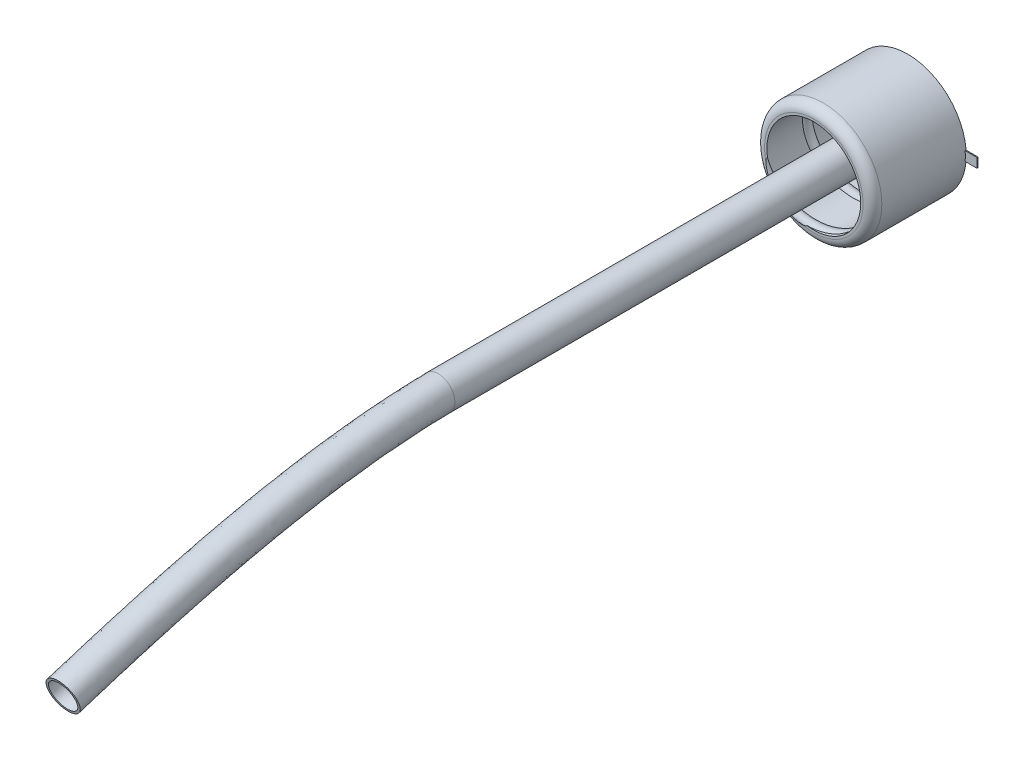
from build123d import *

# Parameters (mm, degrees)
SKETCH1_R            = 15.875
BOSS_EXTRUDE1_DEPTH  = 25.4
SHELL1_T             = -3.175
CUT_SWEEP1_PITCH     = 12.7
CUT_SWEEP1_FROM      = 0
FILLET1_R            = 2.54
BOSS_EXTRUDE2_DEPTH  = 0.254
SWEEP1_PROFILE_R     = 4.445
CUT_SWEEP2_PROFILE_R = 3.81


with BuildPart() as part:
    # Sketch1 → Boss-Extrude1 (new body)
    with BuildSketch(Plane.XY):
        Circle(SKETCH1_R)
    extrude(amount=BOSS_EXTRUDE1_DEPTH)

    # Shell1
    shell1_openings = [part.faces().sort_by_distance(p)[0] for p in [
        (0, 0, 25.4),
    ]]
    offset(amount=SHELL1_T, openings=shell1_openings, kind=Kind.INTERSECTION)

    # Cut-Sweep1: arcs per turn and ends read off the stored shape
    # Cut-Sweep1: the profile of Cut-Sweep1 profile screwed along a left-hand helix through 4.75 turns, 18 arcs to a turn; built about Z, then put on its axis
    cut_sweep1_z = Axis((0, 0, 0), (0, 0, 1))
    cut_sweep1_corners = [(11.43, 0, -12.7), (12.7, -0.199614441, -13.954214525), (13.97, 0, -12.7), (12.7, 0.199614441, -11.445785475)]
    with BuildLine(mode=Mode.PRIVATE) as cut_sweep1_profile:
        ThreePointArc((11.43, 0, -12.7), (11.801974388, -0.141148725, -13.586863596), (12.7, -0.199614441, -13.954214525))
        ThreePointArc((12.7, -0.199614441, -13.954214525), (13.598025612, -0.141148725, -13.586863596), (13.97, 0, -12.7))
        ThreePointArc((13.97, 0, -12.7), (13.598025612, 0.141148725, -11.813136404), (12.7, 0.199614441, -11.445785475))
        ThreePointArc((12.7, 0.199614441, -11.445785475), (11.801974388, 0.141148725, -11.813136404), (11.43, 0, -12.7))
    cut_sweep1_cap = Face(cut_sweep1_profile.wire())
    cut_sweep1_arcs = [((11.43, 0, -12.7), (11.43, -0.199614441, -13.954214525), (12.7, -0.199614441, -13.954214525), (1, 0.7071067811865476, 1)), ((12.7, -0.199614441, -13.954214525), (13.97, -0.199614441, -13.954214525), (13.97, 0, -12.7), (1, 0.7071067811865476, 1)), ((13.97, 0, -12.7), (13.97, 0.199614441, -11.445785475), (12.7, 0.199614441, -11.445785475), (1, 0.7071067811865476, 1)), ((12.7, 0.199614441, -11.445785475), (11.43, 0.199614441, -11.445785475), (11.43, 0, -12.7), (1, 0.7071067811865476, 1))]  # start, shoulder, end, weights
    cut_sweep1_turn_angles = [0, -10, -20, -30, -40, -50, -60, -70, -80, -90, -100, -110, -120, -130, -140, -150, -160, -170, -180, -190, -200, -210, -220, -230, -240, -250, -260, -270, -280, -290, -300, -310, -320, -330, -340, -350, -360]
    cut_sweep1_turn_weights = [1, 0.984807753012208, 1, 0.984807753012208, 1, 0.984807753012208, 1, 0.984807753012208, 1, 0.984807753012208, 1, 0.984807753012208, 1, 0.984807753012208, 1, 0.984807753012208, 1, 0.984807753012208, 1, 0.984807753012208, 1, 0.984807753012208, 1, 0.984807753012208, 1, 0.984807753012208, 1, 0.984807753012208, 1, 0.984807753012208, 1, 0.984807753012208, 1, 0.984807753012208, 1, 0.984807753012208, 1]
    cut_sweep1_turn_sides = [Face.make_bezier_surface([[Vector(p[j][0], p[j][1], 0).rotate(cut_sweep1_z, cut_sweep1_turn_angles[2 * i + k]) / cut_sweep1_turn_weights[2 * i + k] + Vector(0, 0, p[j][2] + -CUT_SWEEP1_PITCH * cut_sweep1_turn_angles[2 * i + k] / 360) for k in range(3)] for j in range(3)], [[p[3][j] * cut_sweep1_turn_weights[2 * i + k] for k in range(3)] for j in range(3)]) for p in cut_sweep1_arcs for i in range(18)]
    cut_sweep1_last_angles = [-1440, -1450, -1460, -1470, -1480, -1490, -1500, -1510, -1520, -1530, -1540, -1550, -1560, -1570, -1580, -1590, -1600, -1610, -1620, -1630, -1640, -1650, -1660, -1670, -1680, -1690, -1700, -1705, -1710]
    cut_sweep1_last_weights = [1, 0.984807753012208, 1, 0.984807753012208, 1, 0.984807753012208, 1, 0.984807753012208, 1, 0.984807753012208, 1, 0.984807753012208, 1, 0.984807753012208, 1, 0.984807753012208, 1, 0.984807753012208, 1, 0.984807753012208, 1, 0.984807753012208, 1, 0.984807753012208, 1, 0.984807753012208, 1, 0.9961946980917455, 1]
    cut_sweep1_last_sides = [Face.make_bezier_surface([[Vector(p[j][0], p[j][1], 0).rotate(cut_sweep1_z, cut_sweep1_last_angles[2 * i + k]) / cut_sweep1_last_weights[2 * i + k] + Vector(0, 0, p[j][2] + -CUT_SWEEP1_PITCH * cut_sweep1_last_angles[2 * i + k] / 360) for k in range(3)] for j in range(3)], [[p[3][j] * cut_sweep1_last_weights[2 * i + k] for k in range(3)] for j in range(3)]) for p in cut_sweep1_arcs for i in range(14)]
    cut_sweep1 = Plane(origin=(0, 0, 3.175), x_dir=(-0.7071067811865512, 0.7071067811865438, 0), z_dir=(0, 0, 1)) * split(Solid(Shell([*[p.moved(Location((0, 0, CUT_SWEEP1_PITCH * i))) for i in range(4) for p in cut_sweep1_turn_sides], *cut_sweep1_last_sides, cut_sweep1_cap, cut_sweep1_cap.rotate(cut_sweep1_z, -1710).moved(Location((0, 0, -CUT_SWEEP1_PITCH * -1710 / 360)))])), bisect_by=Plane.XY.offset(CUT_SWEEP1_FROM), keep=Keep.TOP, mode=Mode.PRIVATE)
    add(cut_sweep1, mode=Mode.SUBTRACT)

    # Fillet1
    # the kernel refuses this fillet: 2.54 mm, written as the material it takes off along each edge
    with BuildSketch(Plane(origin=(0, 0, 25.4), x_dir=(1, 0, 0), z_dir=(0, -1, 0))) as fillet1_piece_1:
        with BuildLine():
            CenterArc((15.875 - FILLET1_R, -FILLET1_R), FILLET1_R, 0, 90)
            Line((15.875 - FILLET1_R, 0), (15.875, 0))
            Line((15.875, 0), (15.875, -FILLET1_R))
        make_face()
    revolve(axis=Axis((0, 0, 25.4), (0, 0, 1)), mode=Mode.SUBTRACT)

    # Sketch4 → Boss-Extrude2 (add)
    with BuildSketch(Plane(origin=(0, 0, 0), x_dir=(-1, 0, 0), z_dir=(0, 0, -1))):
        with BuildLine():
            Line((19.05, 1.27), (15.824118459, 1.27))
            ThreePointArc((15.824118459, 1.27), (15.862274514, 0.635509428), (15.875, 0))
            ThreePointArc((15.875, 0), (15.862274514, -0.635509428), (15.824118459, -1.27))
            Line((15.824118459, -1.27), (19.05, -1.27))
            Line((19.05, -1.27), (19.05, 1.27))
        make_face()
        with BuildLine():
            Line((-15.824118459, 1.27), (-19.05, 1.27))
            Line((-19.05, 1.27), (-19.05, -1.27))
            Line((-19.05, -1.27), (-15.824118459, -1.27))
            ThreePointArc((-15.824118459, -1.27), (-15.875, 0), (-15.824118459, 1.27))
        make_face()
    extrude(amount=-BOSS_EXTRUDE2_DEPTH)

    # Sweep1: sweep along a path in Sketch38
    with BuildLine() as sweep1_path:  # in the path sketch's own coordinates; laid on its plane below (add() does not lay a ready-made edge on the line's plane)
        Line((0, 0), (-127, 0))
        add(Edge.make_bspline(
            [(-127, 0), (-161.940731017, -0.680845409), (-195.618973969, -9.905006077), (-228.6, -20.32)],
            knots=[0, 0, 0, 0, 1, 1, 1, 1], degree=3))
    # Sweep1 profile (on start of the path) → Sweep1 (sweep)
    with BuildSketch(Plane(origin=(0, 0, 0), x_dir=(0, 1, 0), z_dir=(0, 0, 1))):
        Circle(SWEEP1_PROFILE_R)
    sweep(path=Plane(origin=(0, 0, 0), x_dir=(0, 0, -1), z_dir=(1, 0, 0)) * sweep1_path.line, transition=Transition.RIGHT)

    # Cut-Sweep2: sweep along a path in Sketch60
    with BuildLine() as cut_sweep2_path:  # in the path sketch's own coordinates; laid on its plane below (add() does not lay a ready-made edge on the line's plane)
        Line((-2.54, 0), (-127, 0))
        add(Edge.make_bspline(
            [(-127, 0), (-161.940731017, -0.680845409), (-195.618973969, -9.905006077), (-228.6, -20.32)],
            knots=[0, 0, 0, 0, 1, 1, 1, 1], degree=3))
    # Cut-Sweep2 profile (on start of the path) → Cut-Sweep2 (sweep, cut)
    with BuildSketch(Plane(origin=(0, 0, 2.54), x_dir=(0, 1, 0), z_dir=(0, 0, 1))):
        Circle(CUT_SWEEP2_PROFILE_R)
    sweep(path=Plane(origin=(0, 0, 0), x_dir=(0, 0, -1), z_dir=(1, 0, 0)) * cut_sweep2_path.line, transition=Transition.RIGHT, mode=Mode.SUBTRACT)


solid = part.part
